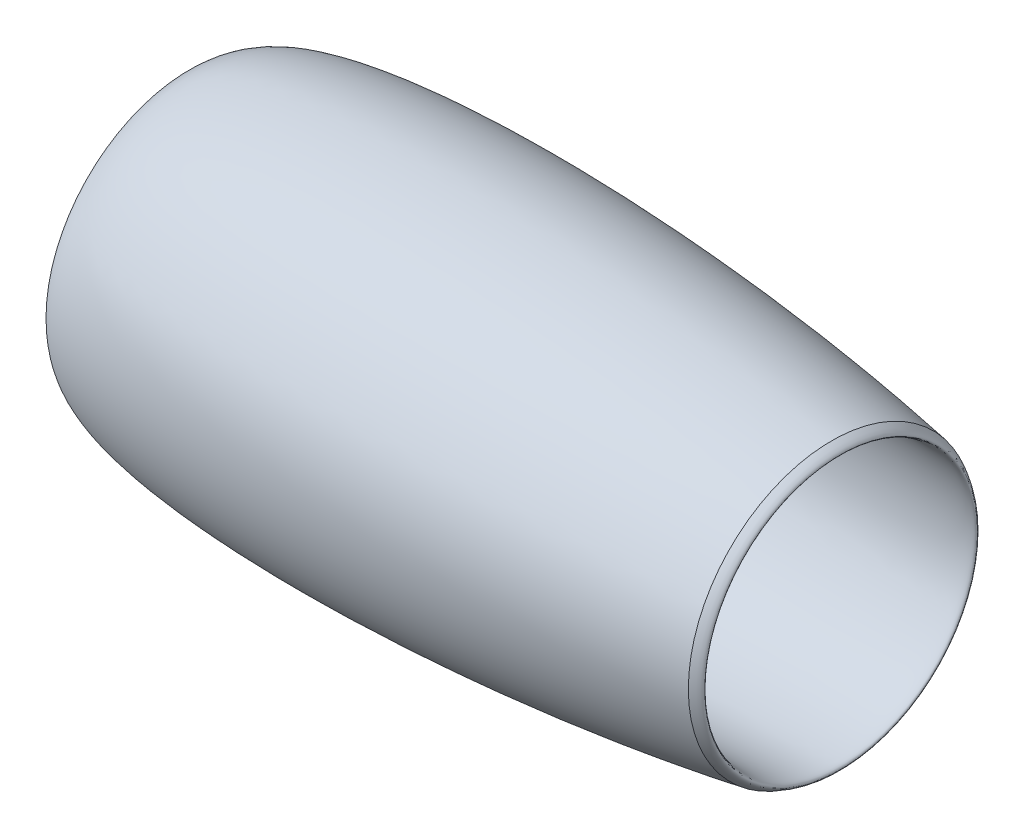
from build123d import *


# Read off the part's stored shape, not the designer's step: Revolve1
with BuildPart() as part:
    # Revolve1 outline → Revolve1 (revolve)
    with BuildSketch(Plane.YX):
        with BuildLine():
            add(Edge.make_bspline(
                [(585, 1310), (580.266384144, 1319.441390823), (575.882602614, 1327.382666856), (571.833860585, 1333.877180415), (484.585039326, 1453.211327038), (565.062927766, 835.682252877), (634.160658136, 98.150388454), (597.657190294, -611.785452452), (470.513965587, -1068.205313164), (300.584735725, -1304.850532477), (540.682617834, -1335.504191569), (585, -1310)],
                knots=[0.957268995, 0.957268995, 0.957268995, 0.957268995, 0.957268995, 0.957268995, 0.957268995, 0.957268995, 0.957268995, 1, 1, 1, 1.957268995, 1.957268995, 1.957268995, 1.957268995, 1.957268995, 1.957268995, 1.957268995, 1.957268995, 1.957268995], degree=8))
            add(Edge.make_bspline(
                [(585, -1310), (770.576698458, -1124.273608822), (781.379838253, 170.320438249), (585, 1310)],
                knots=[0.492933322, 0.492933322, 0.492933322, 0.492933322, 1.492933322, 1.492933322, 1.492933322, 1.492933322], degree=3))
        make_face()
    revolve(axis=Axis((0, 0, 0), (1, 0, 0)))


solid = part.part
